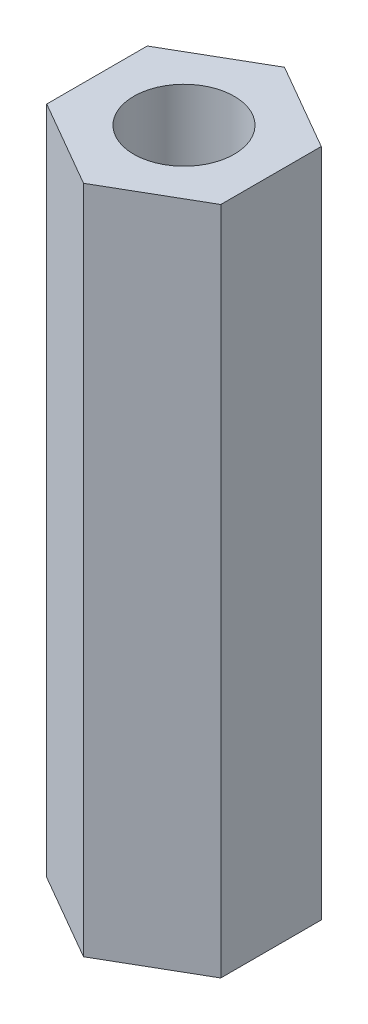
from build123d import *

# Parameters (mm, degrees)
SKETCH1_R           = 1.5
BOSS_EXTRUDE1_DEPTH = 20


with BuildPart() as part:
    # Sketch1 → Boss-Extrude1 (new body)
    with BuildSketch(Plane(origin=(0, 0, 0), x_dir=(1, 0, 0), z_dir=(0, 1, 0))):
        Polygon((0, 3), (-2.598076211, 1.5), (-2.598076211, -1.5), (0, -3), (2.598076211, -1.5), (2.598076211, 1.5), align=None)
        Circle(SKETCH1_R, mode=Mode.SUBTRACT)
    extrude(amount=BOSS_EXTRUDE1_DEPTH)


solid = part.part
